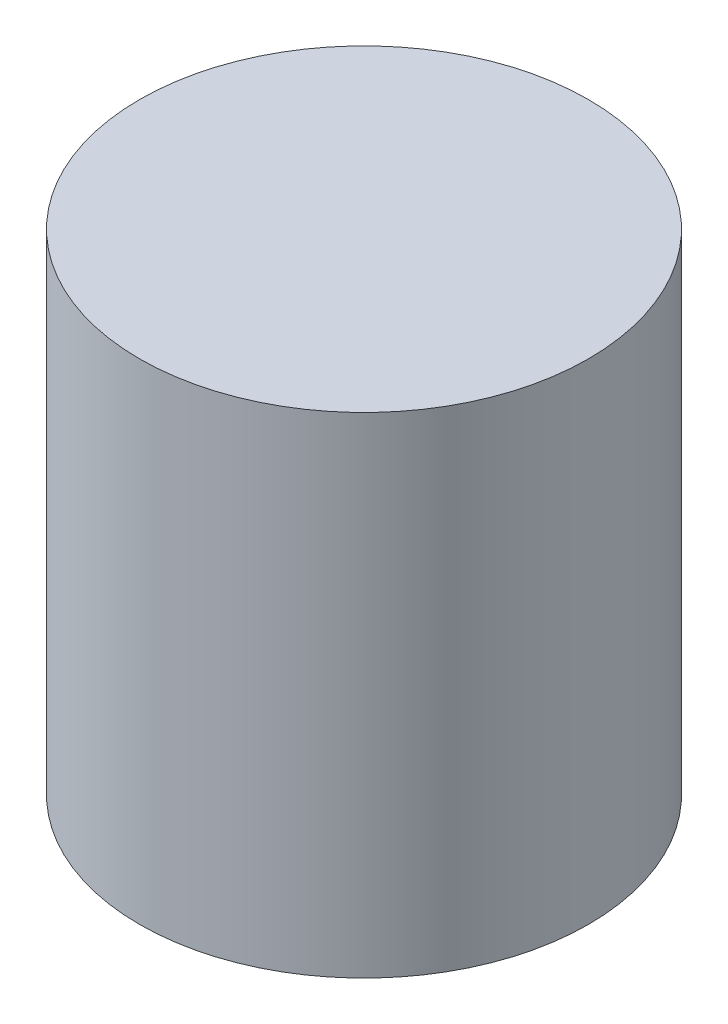
from build123d import *

# Parameters (mm, degrees)
SKETCH2_R           = 69.85
BOSS_EXTRUDE1_DEPTH = 152.4


with BuildPart() as part:
    # Sketch2 → Boss-Extrude1 (new body)
    with BuildSketch(Plane(origin=(0, 0, 0), x_dir=(1, 0, 0), z_dir=(0, 1, 0))):
        Circle(SKETCH2_R)
    extrude(amount=BOSS_EXTRUDE1_DEPTH)


solid = part.part
